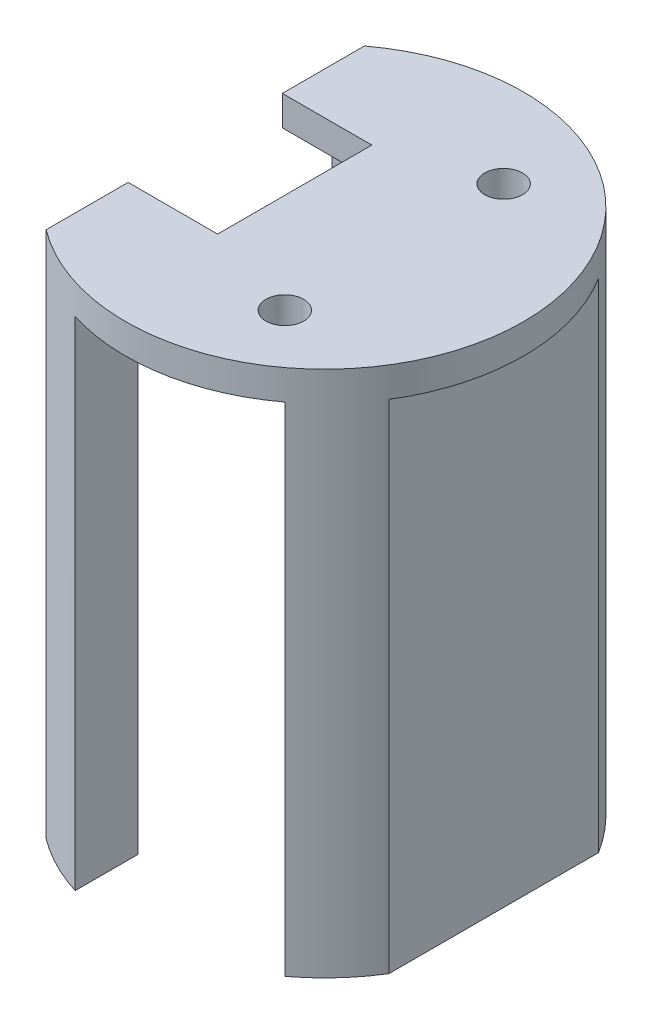
from build123d import *

# Parameters (mm, degrees)
PLATE_DEPTH         = 3.81
BOLTHOLES_REACH     = 38.123
SKETCH15_R          = 2.413
BOSS_EXTRUDE1_START = 63.5
BOSS_EXTRUDE1_DEPTH = 63.5


with BuildPart() as part:
    # Sketch2 → plate (new body)
    with BuildSketch(Plane(origin=(0, 0, 0), x_dir=(1, 0, 0), z_dir=(0, 1, 0))):
        with BuildLine():
            Line((-15.24, -20.32), (-15.24, -9.8425))
            Line((-15.24, -9.8425), (-3.81, -9.8425))
            Line((-3.81, -9.8425), (-3.81, 9.8425))
            Line((-3.81, 9.8425), (-15.24, 9.8425))
            Line((-15.24, 9.8425), (-15.24, 20.32))
            ThreePointArc((-15.24, 20.32), (25.4, 0), (-15.24, -20.32))
        make_face()
    extrude(amount=PLATE_DEPTH)

    # Sketch15 → boltholes (cut, up to next)
    with BuildSketch(Plane.XZ, mode=Mode.PRIVATE) as boltholes_sk1:
        with Locations((8.89, 13.97)):
            Circle(SKETCH15_R)
    boltholes_tool1 = extrude(boltholes_sk1.sketch, amount=-BOLTHOLES_REACH, mode=Mode.PRIVATE) & part.part
    # Sketch15 → boltholes (cut, up to next)
    with BuildSketch(Plane.XZ, mode=Mode.PRIVATE) as boltholes_sk2:
        with Locations((8.89, -13.97)):
            Circle(SKETCH15_R)
    boltholes_tool2 = extrude(boltholes_sk2.sketch, amount=-BOLTHOLES_REACH, mode=Mode.PRIVATE) & part.part
    add(boltholes_tool1.solids().sort_by_distance((8.89, 0, 13.97))[0], mode=Mode.SUBTRACT)
    add(boltholes_tool2.solids().sort_by_distance((8.89, 0, -13.97))[0], mode=Mode.SUBTRACT)

    # Sketch16 → Boss-Extrude1 (add)
    with BuildSketch(Plane.XZ.offset(BOSS_EXTRUDE1_START)):
        with BuildLine():
            Line((-15.24, 16.1925), (-7.62, 16.1925))
            Line((-7.62, 16.1925), (-7.62, 24.230055716))
            ThreePointArc((-7.62, 24.230055716), (-11.595992149, 22.5985169), (-15.24, 20.32))
            Line((-15.24, 20.32), (-15.24, 16.1925))
        make_face()
        with BuildLine():
            Line((15.24, 20.32), (15.24, -20.32))
            ThreePointArc((15.24, -20.32), (18.739054205, -17.146657036), (21.59, -13.380280266))
            Line((21.59, -13.380280266), (21.59, 13.380280266))
            ThreePointArc((21.59, 13.380280266), (18.739054205, 17.146657036), (15.24, 20.32))
        make_face()
        with BuildLine():
            Line((-15.24, -20.32), (-15.24, -16.1925))
            Line((-15.24, -16.1925), (-7.62, -16.1925))
            Line((-7.62, -16.1925), (-7.62, -24.230055716))
            ThreePointArc((-7.62, -24.230055716), (-11.595992149, -22.5985169), (-15.24, -20.32))
        make_face()
    extrude(amount=-BOSS_EXTRUDE1_DEPTH)


solid = part.part
